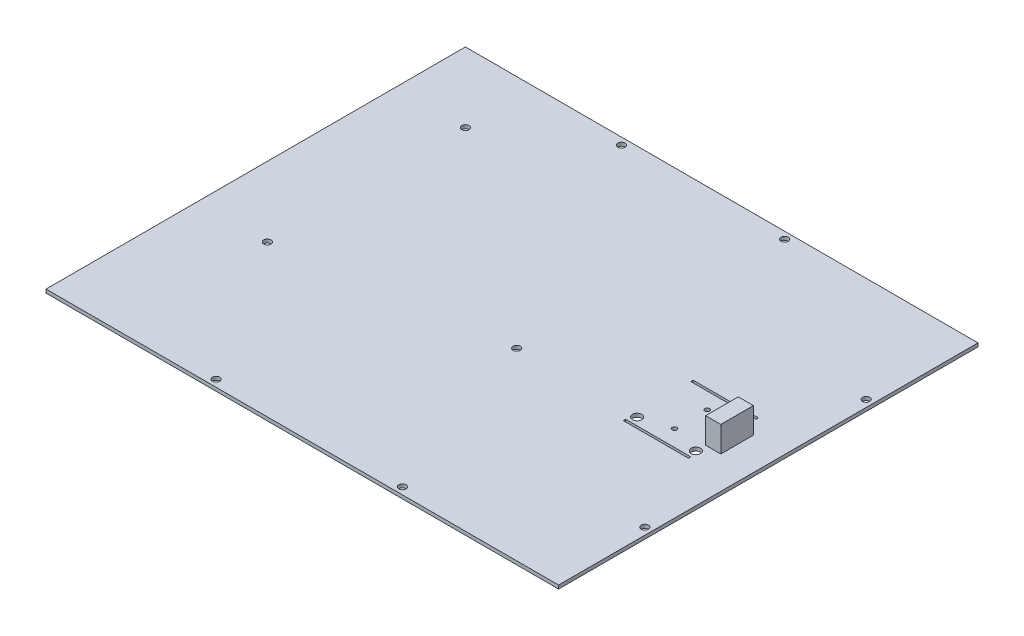
from build123d import *

# Parameters (mm, degrees)
SKETCH1_W           = 220
SKETCH1_H           = 180
SKETCH1_R           = 1.55
BOSS_EXTRUDE1_DEPTH = 1.5
SKETCH_1_R          = 1
SKETCH_1_R_2        = 2
SKETCH_1_W          = 28
SKETCH_1_H          = 1
CUT_EXTRUDE_1_DEPTH = 285.25736578
SKETCH3_W           = 6.5
SKETCH3_H           = 14
BOSS_EXTRUDE2_DEPTH = 11


with BuildPart() as part:
    # Sketch1 → Boss-Extrude1 (new body)
    with BuildSketch(Plane(origin=(0, 0, 0), x_dir=(1, 0, 0), z_dir=(0, 1, 0))):
        with Locations((110, 90)):
            Rectangle(SKETCH1_W, SKETCH1_H)
        with Locations((70, 177)):
            Circle(SKETCH1_R, mode=Mode.SUBTRACT)
        with Locations((140, 177)):
            Circle(SKETCH1_R, mode=Mode.SUBTRACT)
        with Locations((30, 150)):
            Circle(SKETCH1_R, mode=Mode.SUBTRACT)
        with Locations((30, 65)):
            Circle(SKETCH1_R, mode=Mode.SUBTRACT)
        with Locations((217, 40)):
            Circle(SKETCH1_R, mode=Mode.SUBTRACT)
        with Locations((217, 135)):
            Circle(SKETCH1_R, mode=Mode.SUBTRACT)
        with Locations((70, 3)):
            Circle(SKETCH1_R, mode=Mode.SUBTRACT)
        with Locations((150, 3)):
            Circle(SKETCH1_R, mode=Mode.SUBTRACT)
        with Locations((123, 79)):
            Circle(SKETCH1_R, mode=Mode.SUBTRACT)
    extrude(amount=BOSS_EXTRUDE1_DEPTH)

    # Эскиз1 → Вырез-Вытянуть1 (cut, through all)
    with BuildSketch(Plane(origin=(0, 1.5, 0), x_dir=(1, 0, 0), z_dir=(0, 1, 0))):
        with Locations((186.75, 83)):
            Circle(SKETCH_1_R)
        with Locations((186.75, 97)):
            Circle(SKETCH_1_R)
        with Locations((199.6, 79.3)):
            Circle(SKETCH_1_R_2)
        with Locations((199.6, 100.7)):
            Circle(SKETCH_1_R_2)
        with Locations((174.4, 79.3)):
            Circle(SKETCH_1_R_2)
        with Locations((186.75, 75.5)):
            Rectangle(SKETCH_1_W, SKETCH_1_H)
        with Locations((186.75, 104.5)):
            Rectangle(SKETCH_1_W, SKETCH_1_H)
    extrude(amount=-CUT_EXTRUDE_1_DEPTH, mode=Mode.SUBTRACT)

    # Sketch3 → Boss-Extrude2 (add)
    with BuildSketch(Plane(origin=(0, 1.5, 0), x_dir=(1, 0, 0), z_dir=(0, 1, 0))):
        with Locations((202.85, 90.5)):
            Rectangle(SKETCH3_W, SKETCH3_H)
    extrude(amount=BOSS_EXTRUDE2_DEPTH)


solid = part.part
